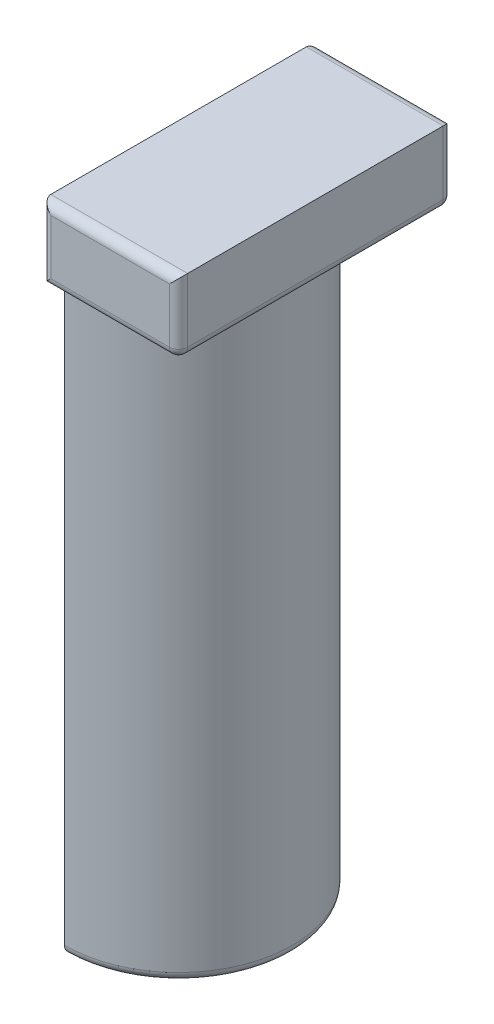
from build123d import *

# Parameters (mm, degrees)
SKETCH_1_W          = 30
SKETCH_1_H          = 30
EXTRUDE_1_DEPTH     = 8
SKETCH_2_R          = 12.5
EXTRUDE_2_DEPTH     = 65
SKETCH_3_W          = 15
SKETCH_3_H          = 30
CUT_EXTRUDE_1_DEPTH = 85.433405711
FILLET_1_R          = 1
FILLET_2_R          = 1


with BuildPart() as part:
    # 草图1 → 凸台-拉伸1 (new body)
    with BuildSketch(Plane(origin=(0, 0, 0), x_dir=(1, 0, 0), z_dir=(0, 1, 0))):
        with Locations((-15, 15)):
            Rectangle(SKETCH_1_W, SKETCH_1_H)
    extrude(amount=EXTRUDE_1_DEPTH)

    # 草图2 → 凸台-拉伸2 (add)
    with BuildSketch(Plane.XZ):
        with Locations((-15, -15)):
            Circle(SKETCH_2_R)
    extrude(amount=EXTRUDE_2_DEPTH)

    # 草图3 → 切除-拉伸1 (cut, through all)
    with BuildSketch(Plane(origin=(0, 8, 0), x_dir=(1, 0, 0), z_dir=(0, 1, 0))):
        with Locations((-22.5, 15)):
            Rectangle(SKETCH_3_W, SKETCH_3_H)
    extrude(amount=-CUT_EXTRUDE_1_DEPTH, mode=Mode.SUBTRACT)

    # 圆角1
    fillet_1_edges = [part.edges().sort_by_distance(p)[0] for p in [
        (-2.5, -65, -15),
    ]]
    fillet(fillet_1_edges, radius=FILLET_1_R)

    # 圆角2
    fillet_2_edges = [part.edges().sort_by_distance(p)[0] for p in [
        (0, 4, -30),
        (-7.5, 8, -30),
        (-15, 4, -30),
        (-7.5, 0, -30),
        (0, 4, 0),
        (-7.5, 0, 0),
        (-15, 4, 0),
        (-7.5, 8, 0),
        (0, 0, -15),
    ]]
    fillet(fillet_2_edges, radius=FILLET_2_R)


solid = part.part
